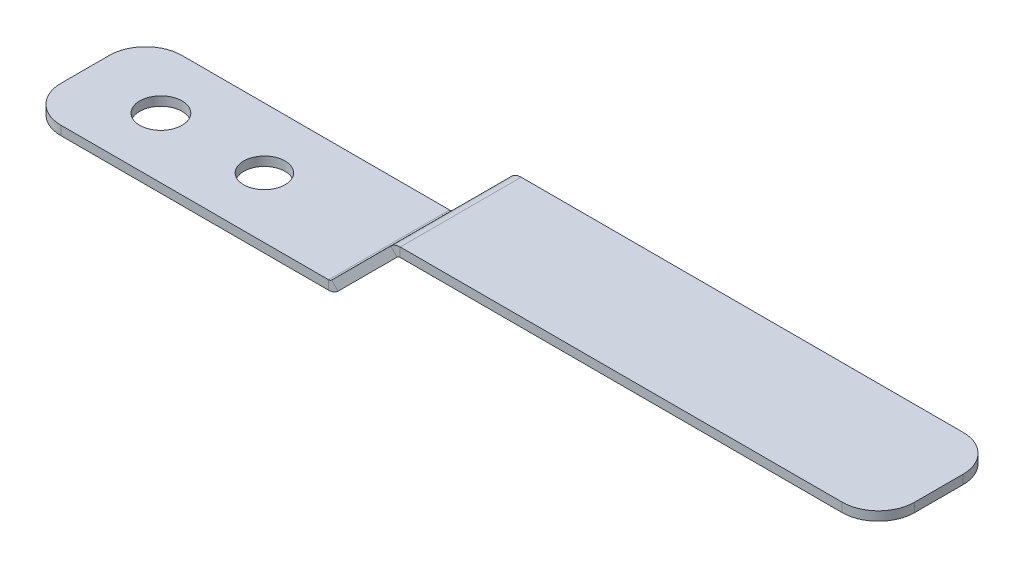
from build123d import *

# Parameters (mm, degrees)
BASE_FLANGE1_DEPTH = 20
SKETCH2_R          = 3.5
CUT_EXTRUDE1_DEPTH = 3
SKETCH3_R          = 3.41681183
CUT_EXTRUDE2_DEPTH = 3
FILLET1_R          = 6


# Sheet-metal steps are written as plain solids
with BuildPart() as part:
    # Sketch1 → Base-Flange1 (new body)
    with BuildSketch(Plane.XY):
        with BuildLine():
            Line((19.18483114, 107.365276831), (69.443546787, 107.365276831))
            ThreePointArc((69.443546787, 107.365276831), (69.725312696, 107.421298009), (69.964219908, 107.580840304))
            Line((69.964219908, 107.580840304), (79.71206519, 117.321886786))
            ThreePointArc((79.71206519, 117.321886786), (80.437479078, 117.806318361), (81.293028401, 117.976420136))
            Line((81.293028401, 117.976420136), (160.367055374, 117.976420136))
            Line((160.367055374, 117.976420136), (160.367055374, 116.476420136))
            Line((160.367055374, 116.476420136), (81.293028401, 116.476420136))
            ThreePointArc((81.293028401, 116.476420136), (81.011262492, 116.420398957), (80.772355281, 116.260856662))
            Line((80.772355281, 116.260856662), (71.024509998, 106.51981018))
            ThreePointArc((71.024509998, 106.51981018), (70.299096111, 106.035378605), (69.443546787, 105.865276831))
            Line((69.443546787, 105.865276831), (19.18483114, 105.865276831))
            Line((19.18483114, 105.865276831), (19.18483114, 107.365276831))
        make_face()
    extrude(amount=BASE_FLANGE1_DEPTH)

    # Sketch2 → Cut-Extrude1 (cut)
    with BuildSketch(Plane(origin=(0, 107.365276831, 0), x_dir=(1, 0, 0), z_dir=(0, 1, 0))):
        with Locations(Location((31.715129554, -10, 0), (0, 0, 270))):
            Circle(SKETCH2_R)
    extrude(amount=-CUT_EXTRUDE1_DEPTH, mode=Mode.SUBTRACT)

    # Sketch3 → Cut-Extrude2 (cut)
    with BuildSketch(Plane(origin=(0, 107.365276831, 0), x_dir=(1, 0, 0), z_dir=(0, 1, 0))):
        with Locations(Location((48.827870371, -10, 0), (0, 0, 270))):
            Circle(SKETCH3_R)
    extrude(amount=-CUT_EXTRUDE2_DEPTH, mode=Mode.SUBTRACT)

    # Fillet1
    fillet1_edges = [part.edges().sort_by_distance(p)[0] for p in [
        (19.18483114, 106.615276831, 0),
        (160.367055374, 117.226420136, 0),
        (19.18483114, 106.615276831, 20),
        (160.367055374, 117.226420136, 20),
    ]]
    fillet(fillet1_edges, radius=FILLET1_R)


solid = part.part
